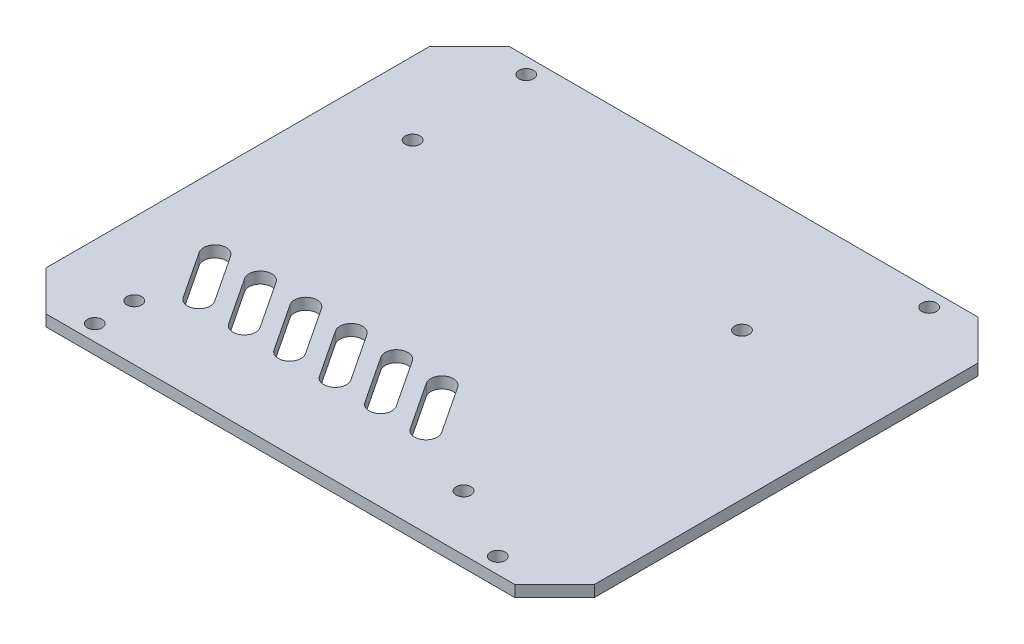
from build123d import *

# Parameters (mm, degrees)
EXTRUDE_1_DEPTH     = 2
CUT_EXTRUDE_1_REACH = 72.175
SKETCH_2_R          = 1.3
CUT_EXTRUDE_2_REACH = 72.175
SKETCH_3_R          = 1.3
CUT_EXTRUDE_3_REACH = 72.175


with BuildPart() as part:
    # 草图1 → 凸台-拉伸1 (new body)
    with BuildSketch(Plane.XZ.offset(18.39)):
        Polygon((-51.8, -40.295836944), (-44.795836944, -47.3), (37.795836944, -47.3), (44.8, -40.295836944), (44.8, 27.295836944), (37.795836944, 34.3), (-44.795836944, 34.3), (-51.8, 27.295836944), align=None)
    extrude(amount=EXTRUDE_1_DEPTH)

    # 草图2 → 切除-拉伸1 (cut, up to next)
    with BuildSketch(Plane.XZ.offset(20.39), mode=Mode.PRIVATE) as cut_extrude_1_sk1:
        with Locations((-39.011567772, -24.5)):
            Circle(SKETCH_2_R)
    cut_extrude_1_tool1 = extrude(cut_extrude_1_sk1.sketch, amount=-CUT_EXTRUDE_1_REACH, mode=Mode.PRIVATE) & part.part
    # 草图2 → 切除-拉伸1 (cut, up to next)
    with BuildSketch(Plane.XZ.offset(20.39), mode=Mode.PRIVATE) as cut_extrude_1_sk2:
        with Locations((19, -24.5)):
            Circle(SKETCH_2_R)
    cut_extrude_1_tool2 = extrude(cut_extrude_1_sk2.sketch, amount=-CUT_EXTRUDE_1_REACH, mode=Mode.PRIVATE) & part.part
    # 草图2 → 切除-拉伸1 (cut, up to next)
    with BuildSketch(Plane.XZ.offset(20.39), mode=Mode.PRIVATE) as cut_extrude_1_sk3:
        with Locations((-39.011567772, 24.535212594)):
            Circle(SKETCH_2_R)
    cut_extrude_1_tool3 = extrude(cut_extrude_1_sk3.sketch, amount=-CUT_EXTRUDE_1_REACH, mode=Mode.PRIVATE) & part.part
    # 草图2 → 切除-拉伸1 (cut, up to next)
    with BuildSketch(Plane.XZ.offset(20.39), mode=Mode.PRIVATE) as cut_extrude_1_sk4:
        with Locations((19, 24.535212594)):
            Circle(SKETCH_2_R)
    cut_extrude_1_tool4 = extrude(cut_extrude_1_sk4.sketch, amount=-CUT_EXTRUDE_1_REACH, mode=Mode.PRIVATE) & part.part
    add(cut_extrude_1_tool1.solids().sort_by_distance((-39.011568, -20.39, -24.5))[0], mode=Mode.SUBTRACT)
    add(cut_extrude_1_tool2.solids().sort_by_distance((19, -20.39, -24.5))[0], mode=Mode.SUBTRACT)
    add(cut_extrude_1_tool3.solids().sort_by_distance((-39.011568, -20.39, 24.535213))[0], mode=Mode.SUBTRACT)
    add(cut_extrude_1_tool4.solids().sort_by_distance((19, -20.39, 24.535213))[0], mode=Mode.SUBTRACT)

    # 草图3 → 切除-拉伸2 (cut, up to next)
    with BuildSketch(Plane.XZ.offset(20.39), mode=Mode.PRIVATE) as cut_extrude_2_sk1:
        with Locations((32, -44.5)):
            Circle(SKETCH_3_R)
    cut_extrude_2_tool1 = extrude(cut_extrude_2_sk1.sketch, amount=-CUT_EXTRUDE_2_REACH, mode=Mode.PRIVATE) & part.part
    # 草图3 → 切除-拉伸2 (cut, up to next)
    with BuildSketch(Plane.XZ.offset(20.39), mode=Mode.PRIVATE) as cut_extrude_2_sk2:
        with Locations((-39, -44.5)):
            Circle(SKETCH_3_R)
    cut_extrude_2_tool2 = extrude(cut_extrude_2_sk2.sketch, amount=-CUT_EXTRUDE_2_REACH, mode=Mode.PRIVATE) & part.part
    # 草图3 → 切除-拉伸2 (cut, up to next)
    with BuildSketch(Plane.XZ.offset(20.39), mode=Mode.PRIVATE) as cut_extrude_2_sk3:
        with Locations((32, 31.5)):
            Circle(SKETCH_3_R)
    cut_extrude_2_tool3 = extrude(cut_extrude_2_sk3.sketch, amount=-CUT_EXTRUDE_2_REACH, mode=Mode.PRIVATE) & part.part
    # 草图3 → 切除-拉伸2 (cut, up to next)
    with BuildSketch(Plane.XZ.offset(20.39), mode=Mode.PRIVATE) as cut_extrude_2_sk4:
        with Locations((-39, 31.5)):
            Circle(SKETCH_3_R)
    cut_extrude_2_tool4 = extrude(cut_extrude_2_sk4.sketch, amount=-CUT_EXTRUDE_2_REACH, mode=Mode.PRIVATE) & part.part
    add(cut_extrude_2_tool1.solids().sort_by_distance((32, -20.39, -44.5))[0], mode=Mode.SUBTRACT)
    add(cut_extrude_2_tool2.solids().sort_by_distance((-39, -20.39, -44.5))[0], mode=Mode.SUBTRACT)
    add(cut_extrude_2_tool3.solids().sort_by_distance((32, -20.39, 31.5))[0], mode=Mode.SUBTRACT)
    add(cut_extrude_2_tool4.solids().sort_by_distance((-39, -20.39, 31.5))[0], mode=Mode.SUBTRACT)

    # 草图4 → 切除-拉伸3 (cut, up to next)
    with BuildSketch(Plane.XZ.offset(20.39), mode=Mode.PRIVATE) as cut_extrude_3_sk1:
        with BuildLine():
            Line((-40.69671065, 11.402772719), (-35.182847057, 19.74527284))
            ThreePointArc((-35.182847057, 19.74527284), (-32.411574314, 20.311000146), (-31.845847008, 17.539727403))
            Line((-31.845847008, 17.539727403), (-37.359710601, 9.197227281))
            ThreePointArc((-37.359710601, 9.197227281), (-40.130983344, 8.631499976), (-40.69671065, 11.402772719))
        make_face()
    cut_extrude_3_tool1 = extrude(cut_extrude_3_sk1.sketch, amount=-CUT_EXTRUDE_3_REACH, mode=Mode.PRIVATE) & part.part
    # 草图4 → 切除-拉伸3 (cut, up to next)
    with BuildSketch(Plane.XZ.offset(20.39), mode=Mode.PRIVATE) as cut_extrude_3_sk2:
        with BuildLine():
            Line((-32.69671065, 11.402772719), (-27.182847057, 19.74527284))
            ThreePointArc((-27.182847057, 19.74527284), (-24.411574314, 20.311000146), (-23.845847008, 17.539727403))
            Line((-23.845847008, 17.539727403), (-29.359710601, 9.197227281))
            ThreePointArc((-29.359710601, 9.197227281), (-32.130983344, 8.631499976), (-32.69671065, 11.402772719))
        make_face()
    cut_extrude_3_tool2 = extrude(cut_extrude_3_sk2.sketch, amount=-CUT_EXTRUDE_3_REACH, mode=Mode.PRIVATE) & part.part
    # 草图4 → 切除-拉伸3 (cut, up to next)
    with BuildSketch(Plane.XZ.offset(20.39), mode=Mode.PRIVATE) as cut_extrude_3_sk3:
        with BuildLine():
            Line((-24.69671065, 11.402772719), (-19.182847057, 19.74527284))
            ThreePointArc((-19.182847057, 19.74527284), (-16.411574314, 20.311000146), (-15.845847008, 17.539727403))
            Line((-15.845847008, 17.539727403), (-21.359710601, 9.197227281))
            ThreePointArc((-21.359710601, 9.197227281), (-24.130983344, 8.631499976), (-24.69671065, 11.402772719))
        make_face()
    cut_extrude_3_tool3 = extrude(cut_extrude_3_sk3.sketch, amount=-CUT_EXTRUDE_3_REACH, mode=Mode.PRIVATE) & part.part
    # 草图4 → 切除-拉伸3 (cut, up to next)
    with BuildSketch(Plane.XZ.offset(20.39), mode=Mode.PRIVATE) as cut_extrude_3_sk4:
        with BuildLine():
            Line((-16.69671065, 11.402772719), (-11.182847057, 19.74527284))
            ThreePointArc((-11.182847057, 19.74527284), (-8.411574314, 20.311000146), (-7.845847008, 17.539727403))
            Line((-7.845847008, 17.539727403), (-13.359710601, 9.197227281))
            ThreePointArc((-13.359710601, 9.197227281), (-16.130983344, 8.631499976), (-16.69671065, 11.402772719))
        make_face()
    cut_extrude_3_tool4 = extrude(cut_extrude_3_sk4.sketch, amount=-CUT_EXTRUDE_3_REACH, mode=Mode.PRIVATE) & part.part
    # 草图4 → 切除-拉伸3 (cut, up to next)
    with BuildSketch(Plane.XZ.offset(20.39), mode=Mode.PRIVATE) as cut_extrude_3_sk5:
        with BuildLine():
            Line((-8.69671065, 11.402772719), (-3.182847057, 19.74527284))
            ThreePointArc((-3.182847057, 19.74527284), (-0.411574314, 20.311000146), (0.154152992, 17.539727403))
            Line((0.154152992, 17.539727403), (-5.359710601, 9.197227281))
            ThreePointArc((-5.359710601, 9.197227281), (-8.130983344, 8.631499976), (-8.69671065, 11.402772719))
        make_face()
    cut_extrude_3_tool5 = extrude(cut_extrude_3_sk5.sketch, amount=-CUT_EXTRUDE_3_REACH, mode=Mode.PRIVATE) & part.part
    # 草图4 → 切除-拉伸3 (cut, up to next)
    with BuildSketch(Plane.XZ.offset(20.39), mode=Mode.PRIVATE) as cut_extrude_3_sk6:
        with BuildLine():
            Line((-0.69671065, 11.402772719), (4.817152943, 19.74527284))
            ThreePointArc((4.817152943, 19.74527284), (7.588425686, 20.311000146), (8.154152992, 17.539727403))
            Line((8.154152992, 17.539727403), (2.640289399, 9.197227281))
            ThreePointArc((2.640289399, 9.197227281), (-0.130983344, 8.631499976), (-0.69671065, 11.402772719))
        make_face()
    cut_extrude_3_tool6 = extrude(cut_extrude_3_sk6.sketch, amount=-CUT_EXTRUDE_3_REACH, mode=Mode.PRIVATE) & part.part
    add(cut_extrude_3_tool1.solids().sort_by_distance((-36.271279, -20.39, 14.47125))[0], mode=Mode.SUBTRACT)
    add(cut_extrude_3_tool2.solids().sort_by_distance((-28.271279, -20.39, 14.47125))[0], mode=Mode.SUBTRACT)
    add(cut_extrude_3_tool3.solids().sort_by_distance((-20.271279, -20.39, 14.47125))[0], mode=Mode.SUBTRACT)
    add(cut_extrude_3_tool4.solids().sort_by_distance((-12.271279, -20.39, 14.47125))[0], mode=Mode.SUBTRACT)
    add(cut_extrude_3_tool5.solids().sort_by_distance((-4.271279, -20.39, 14.47125))[0], mode=Mode.SUBTRACT)
    add(cut_extrude_3_tool6.solids().sort_by_distance((3.728721, -20.39, 14.47125))[0], mode=Mode.SUBTRACT)


solid = part.part
